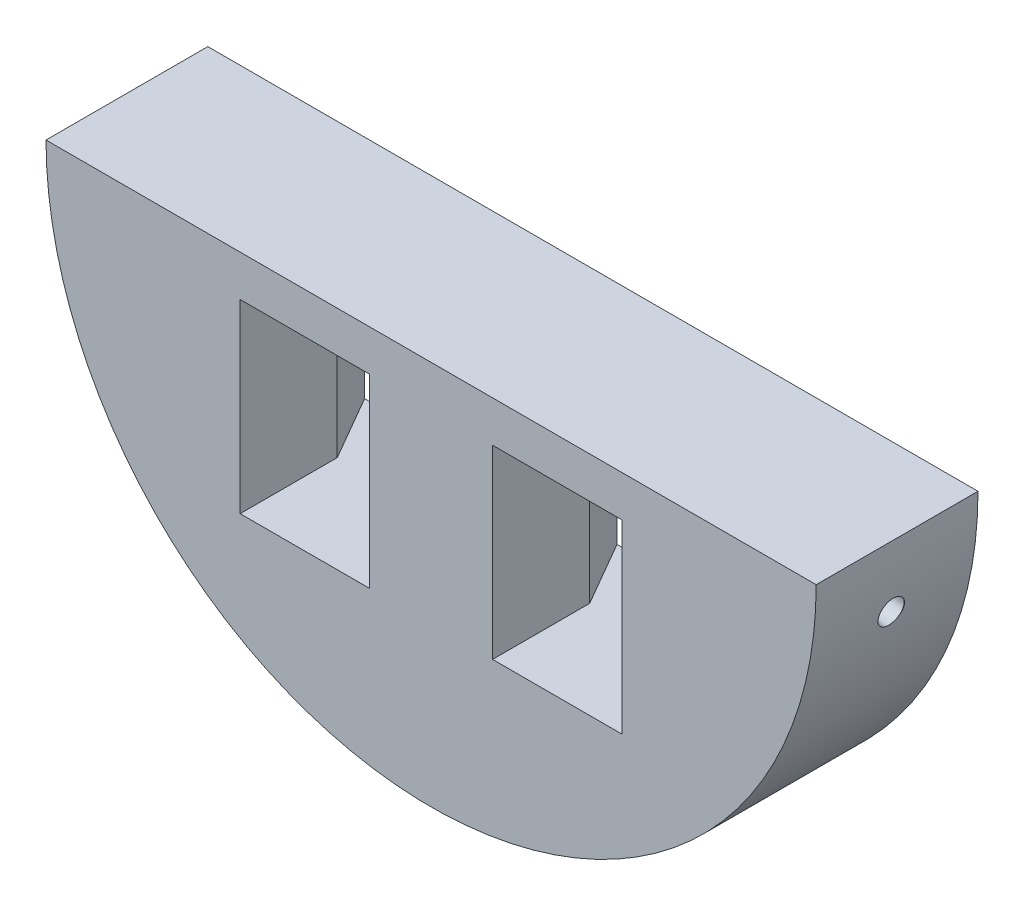
from build123d import *
from OCP.BRepFilletAPI import BRepFilletAPI_MakeChamfer

# Parameters (mm, degrees)
SKETCH1_W           = 20
SKETCH1_H           = 20
BOSS_EXTRUDE1_DEPTH = 25
CIRPATTERN1_COUNT   = 5
CIRPATTERN1_ANGLE   = 160
CHAMFER1_SIZE       = 15
CHAMFER1_SIZE2      = 8.660254038
CHAMFER2_SIZE       = 10
CHAMFER2_SIZE2      = 5.773502692


with BuildPart() as part:
    # Sketch1 → Boss-Extrude1 (new body)
    with BuildSketch(Plane.XY):
        with BuildLine():
            Line((-119, 0), (0, 0))
            ThreePointArc((0, 0), (-59.5, -59.5), (-119, 0))
        make_face()
        with Locations((-40, -25)):
            Rectangle(SKETCH1_W, SKETCH1_H, mode=Mode.SUBTRACT)
        with Locations((-79, -25)):
            Rectangle(SKETCH1_W, SKETCH1_H, mode=Mode.SUBTRACT)
    extrude(amount=BOSS_EXTRUDE1_DEPTH)

    # Sketch4 → Ø4.0mm Dowel Hole2 (revolve, cut)
    with BuildSketch(Plane(origin=(-0.903938696, -10.332066571, 12.5), x_dir=(0.1736481776669305, 0.9848077530122081, 0), z_dir=(0, 0, 1))):
        Polygon((0, 0), (0, 11.201721238), (2, 10), (2, 0.025), (2.025, 0), align=None)
    f_4_0mm_dowel_hole2 = revolve(axis=Axis((5.349590536, -11.434732499, 12.5), (-0.9848077530122081, 0.1736481776669305, 0)), mode=Mode.SUBTRACT)

    # CirPattern1: Ø4.0mm Dowel Hole2 ×5 about axis
    cirpattern1_axis = Axis((-59.5, 0, 0), (0, 0, -1))
    for i in range(1, CIRPATTERN1_COUNT):
        add(f_4_0mm_dowel_hole2.rotate(cirpattern1_axis, i * CIRPATTERN1_ANGLE / (CIRPATTERN1_COUNT - 1)), mode=Mode.SUBTRACT)

    # Chamfer1: one chamfer whose edges measure the first distance from different faces: ONE call of the kernel's chamfer builder (chamfer() names one face for all edges)
    chamfer1_edges_1 = [part.edges().sort_by_distance(p)[0] for p in [
        (-79, -15, 25),
    ]]
    chamfer1_side_1 = [part.faces().sort_by_distance(p)[0] for p in [
        (-79, -15, 12.5),
    ]]
    chamfer1_edges_2 = [part.edges().sort_by_distance(p)[0] for p in [
        (-40, -15, 25),
    ]]
    chamfer1_side_2 = [part.faces().sort_by_distance(p)[0] for p in [
        (-40, -15, 12.5),
    ]]
    chamfer1 = BRepFilletAPI_MakeChamfer(part.part.solid().wrapped)
    for e in chamfer1_edges_1:
        chamfer1.Add(CHAMFER1_SIZE, CHAMFER1_SIZE2, e.wrapped, chamfer1_side_1[0].wrapped)  # the first distance lies on this face
    for e in chamfer1_edges_2:
        chamfer1.Add(CHAMFER1_SIZE, CHAMFER1_SIZE2, e.wrapped, chamfer1_side_2[0].wrapped)  # the first distance lies on this face
    add(Compound.cast(chamfer1.Shape()), mode=Mode.REPLACE)

    # Chamfer2: one chamfer whose edges measure the first distance from different faces: ONE call of the kernel's chamfer builder (chamfer() names one face for all edges)
    chamfer2_edges_1 = [part.edges().sort_by_distance(p)[0] for p in [
        (-50, -25, 0),
    ]]
    chamfer2_side_1 = [part.faces().sort_by_distance(p)[0] for p in [
        (-50, -23.518424232, 13.362266832),
    ]]
    chamfer2_edges_2 = [part.edges().sort_by_distance(p)[0] for p in [
        (-30, -25, 0),
    ]]
    chamfer2_side_2 = [part.faces().sort_by_distance(p)[0] for p in [
        (-30, -23.518424232, 13.362266832),
    ]]
    chamfer2_edges_3 = [part.edges().sort_by_distance(p)[0] for p in [
        (-89, -25, 0),
    ]]
    chamfer2_side_3 = [part.faces().sort_by_distance(p)[0] for p in [
        (-89, -23.518424232, 13.362266832),
    ]]
    chamfer2_edges_4 = [part.edges().sort_by_distance(p)[0] for p in [
        (-69, -25, 0),
    ]]
    chamfer2_side_4 = [part.faces().sort_by_distance(p)[0] for p in [
        (-69, -23.518424232, 13.362266832),
    ]]
    chamfer2 = BRepFilletAPI_MakeChamfer(part.part.solid().wrapped)
    for e in chamfer2_edges_1:
        chamfer2.Add(CHAMFER2_SIZE, CHAMFER2_SIZE2, e.wrapped, chamfer2_side_1[0].wrapped)  # the first distance lies on this face
    for e in chamfer2_edges_2:
        chamfer2.Add(CHAMFER2_SIZE, CHAMFER2_SIZE2, e.wrapped, chamfer2_side_2[0].wrapped)  # the first distance lies on this face
    for e in chamfer2_edges_3:
        chamfer2.Add(CHAMFER2_SIZE, CHAMFER2_SIZE2, e.wrapped, chamfer2_side_3[0].wrapped)  # the first distance lies on this face
    for e in chamfer2_edges_4:
        chamfer2.Add(CHAMFER2_SIZE, CHAMFER2_SIZE2, e.wrapped, chamfer2_side_4[0].wrapped)  # the first distance lies on this face
    add(Compound.cast(chamfer2.Shape()), mode=Mode.REPLACE)


solid = part.part
